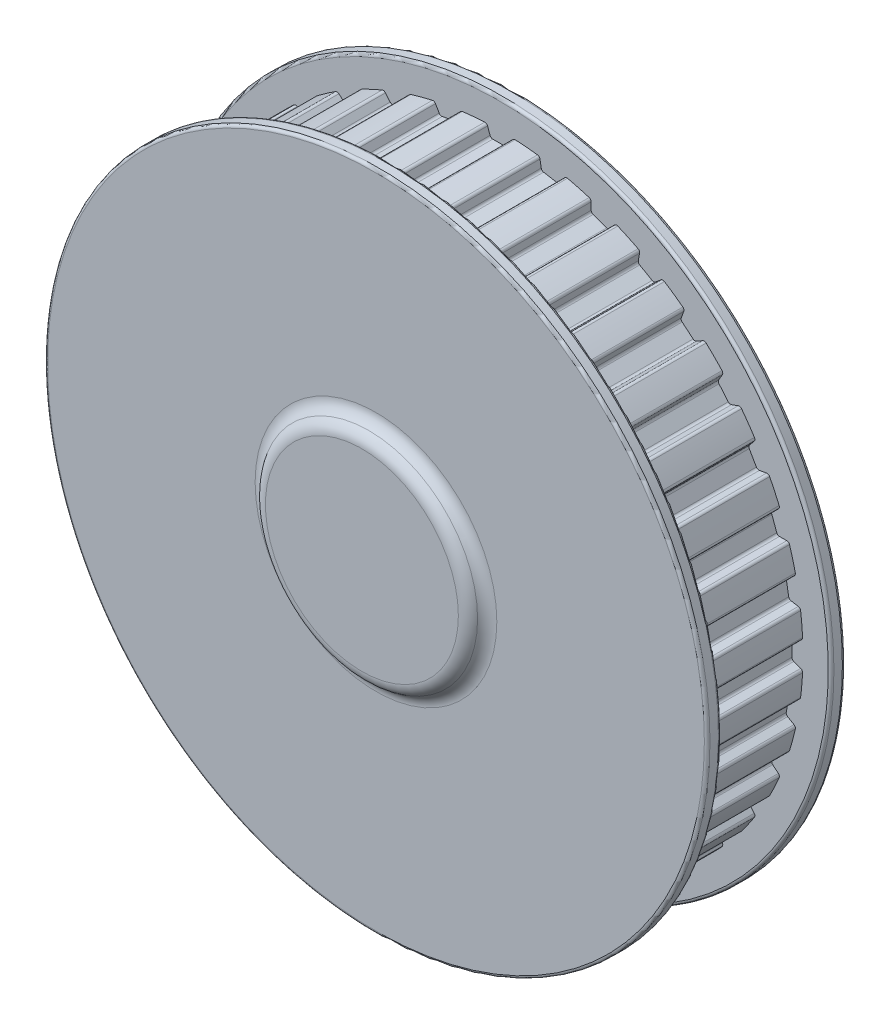
from build123d import *

# Parameters (mm, degrees)
BOSS_EXTRUDE1_DEPTH      = 7.25
BOSS_EXTRUDE1_DEPTH_BACK = 7.25
SKETCH7_R                = 53.784733566
CUT_EXTRUDE3_DEPTH       = 79.163899145
CUT_EXTRUDE3_DEPTH_BACK  = 79.163899145
SKETCH15_R               = 8.008120878
SKETCH15_R_2             = 2.25
BOSS_EXTRUDE2_DEPTH      = 5.5
SKETCH16_R               = 5
CUT_EXTRUDE4_DEPTH       = 3
BOSS_EXTRUDE3_START      = 7.5
SKETCH17_R               = 53.784733566
SKETCH17_R_2             = 5
BOSS_EXTRUDE3_DEPTH      = 7.5
CUT_EXTRUDE2_DEPTH       = 79.163899145
CUT_EXTRUDE2_DEPTH_BACK  = 79.163899145
FILLET2_R                = 0.51
BOSS_EXTRUDE4_START      = 2.5
SKETCH18_R               = 58.784733566
SKETCH18_R_2             = 53.784733566
SKETCH18_R_3             = 5
BOSS_EXTRUDE4_DEPTH      = 2.5
BOSS_EXTRUDE5_START      = -2.5
SKETCH19_R               = 58.784733566
SKETCH19_R_2             = 19
BOSS_EXTRUDE5_DEPTH      = 2.5
CUT_EXTRUDE5_DEPTH       = 91.298683827
FILLET3_R                = 0.5
CUT_EXTRUDE6_DEPTH       = 86.060506795
CUT_EXTRUDE6_DEPTH_BACK  = 86.060506795
SKETCH21_R               = 12.5
SKETCH22_R               = 18.951921224
CUT_EXTRUDE7_DEPTH       = 87.669139909
SKETCH22_2_R             = 18.951921224
BOSS_EXTRUDE6_DEPTH      = 2.5
FILLET4_R                = 2.5
FILLET5_R                = 2.5


with BuildPart() as part:
    # Sketch7 → Boss-Extrude1 (new, two sides: drawn at the far end of the back side and taken through both)
    with BuildSketch(Plane.XY.offset(-BOSS_EXTRUDE1_DEPTH_BACK)):
        Circle(SKETCH7_R)
    extrude(amount=BOSS_EXTRUDE1_DEPTH + BOSS_EXTRUDE1_DEPTH_BACK)

    # Sketch14 → Revolve1 (revolve)
    with BuildSketch(Plane(origin=(0, 0, 0), x_dir=(0, 0, -1), z_dir=(1, 0, 0)), mode=Mode.PRIVATE) as revolve1_sk:
        Polygon((-18, 6.739517467), (-18, 0), (0, 0), (0, 19), (-3.355534752, 19), (-11.020158508, 12.583105693), align=None)
        with BuildLine():
            ThreePointArc((-7.25, 19), (-8.580081567, 15.465471544), (-11.020158508, 12.583105693))
            Line((-11.020158508, 12.583105693), (-3.355534752, 19))
            Line((-3.355534752, 19), (-7.25, 19))
        make_face()
        with BuildLine():
            Line((-18, 10), (-18, 6.739517467))
            Line((-18, 6.739517467), (-11.020158508, 12.583105693))
            ThreePointArc((-11.020158508, 12.583105693), (-14.286666254, 10.687865845), (-18, 10))
        make_face()
    revolve(revolve1_sk.sketch.rotate(Axis((0, 0, -36.129595921), (0, 0, 1)), 270), axis=Axis((0, 0, -36.129595921), (0, 0, 1)))

    # Sketch10 → Cut-Extrude3 (cut, two sides: drawn at the far end of the back side and taken through both)
    with BuildSketch(Plane.XY.offset(-CUT_EXTRUDE3_DEPTH_BACK)):
        with BuildLine():
            Line((2.2, 7.7), (-2.2, 7.7))
            Line((-2.2, 7.7), (-2.2, 5.796550698))
            ThreePointArc((-2.2, 5.796550698), (0, 6.2), (2.2, 5.796550698))
            Line((2.2, 5.796550698), (2.2, 7.7))
        make_face()
        with BuildLine():
            ThreePointArc((2.2, 5.796550698), (0, 6.2), (-2.2, 5.796550698))
            Line((-2.2, 5.796550698), (-2.2, 0))
            Line((-2.2, 0), (2.2, 0))
            Line((2.2, 0), (2.2, 5.796550698))
        make_face()
        with BuildLine():
            Line((-2.2, 0), (-2.2, 5.796550698))
            ThreePointArc((-2.2, 5.796550698), (-3.521363372, -5.102940329), (6.2, 0))
            ThreePointArc((6.2, 0), (5.102940329, 3.521363372), (2.2, 5.796550698))
            Line((2.2, 5.796550698), (2.2, 0))
            Line((2.2, 0), (-2.2, 0))
        make_face()
    extrude(amount=CUT_EXTRUDE3_DEPTH + CUT_EXTRUDE3_DEPTH_BACK, mode=Mode.SUBTRACT)

    # Sketch15 → Boss-Extrude2 (add)
    with BuildSketch(Plane(origin=(0, 0, -7.25), x_dir=(-1, 0, 0), z_dir=(0, 0, -1))):
        Circle(SKETCH15_R)
        Circle(SKETCH15_R_2, mode=Mode.SUBTRACT)
    extrude(amount=-BOSS_EXTRUDE2_DEPTH)

    # Sketch16 → Cut-Extrude4 (cut)
    with BuildSketch(Plane(origin=(0, 0, -7.25), x_dir=(-1, 0, 0), z_dir=(0, 0, -1))):
        Circle(SKETCH16_R)
    extrude(amount=-CUT_EXTRUDE4_DEPTH, mode=Mode.SUBTRACT)

    # Sketch17 → Boss-Extrude3 (add)
    with BuildSketch(Plane(origin=(0, 0, -7.25), x_dir=(-1, 0, 0), z_dir=(0, 0, -1)).offset(BOSS_EXTRUDE3_START)):
        with Locations(Location((0, 0, 0), (0, 0, 180))):
            Circle(SKETCH17_R)
        Circle(SKETCH17_R_2, mode=Mode.SUBTRACT)
    extrude(amount=-BOSS_EXTRUDE3_DEPTH)

    # Sketch8 → Cut-Extrude2 (cut, two sides: drawn at the far end of the back side and taken through both)
    with BuildSketch(Plane.XY.offset(-CUT_EXTRUDE2_DEPTH_BACK)):
        Polygon((-1.629816853, 51.824457658), (-2.343298934, 53.784733566), (2.343298934, 53.784733566), (1.629816853, 51.824457658), align=None)
        Polygon((7.394166358, 51.320142423), (7.031922012, 53.374532199), (11.647319928, 52.56071302), (10.604278903, 50.754112971), align=None)
        Polygon((16.193481566, 49.256490631), (16.193481566, 51.34257268), (20.597443, 49.739661806), (19.256535305, 48.141630244), align=None)
        Polygon((24.500766031, 45.696205295), (24.863010377, 47.750595071), (28.921723189, 45.407296137), (27.323691627, 44.066388443), align=None)
        Polygon((32.063607118, 40.747463885), (32.777089199, 42.707739794), (36.367231454, 39.695252752), (34.560631404, 38.652211727), align=None)
        Polygon((38.652211727, 34.560631404), (39.695252752, 36.367231454), (42.707739794, 32.777089199), (40.747463885, 32.063607118), align=None)
        Polygon((44.066388443, 27.323691627), (45.407296137, 28.921723189), (47.750595071, 24.863010377), (45.696205295, 24.500766031), align=None)
        Polygon((48.141630244, 19.256535305), (49.739661806, 20.597443), (51.34257268, 16.193481566), (49.256490631, 16.193481566), align=None)
        Polygon((50.754112971, 10.604278903), (52.56071302, 11.647319928), (53.374532199, 7.031922012), (51.320142423, 7.394166358), align=None)
        Polygon((51.824457658, 1.629816853), (53.784733566, 2.343298934), (53.784733566, -2.343298934), (51.824457658, -1.629816853), align=None)
        Polygon((51.320142423, -7.394166358), (53.374532199, -7.031922012), (52.56071302, -11.647319928), (50.754112971, -10.604278903), align=None)
        Polygon((49.256490631, -16.193481566), (51.34257268, -16.193481566), (49.739661806, -20.597443), (48.141630244, -19.256535305), align=None)
        Polygon((45.696205295, -24.500766031), (47.750595071, -24.863010377), (45.407296137, -28.921723189), (44.066388443, -27.323691627), align=None)
        Polygon((40.747463885, -32.063607118), (42.707739794, -32.777089199), (39.695252752, -36.367231454), (38.652211727, -34.560631404), align=None)
        Polygon((34.560631404, -38.652211727), (36.367231454, -39.695252752), (32.777089199, -42.707739794), (32.063607118, -40.747463885), align=None)
        Polygon((27.323691627, -44.066388443), (28.921723189, -45.407296137), (24.863010377, -47.750595071), (24.500766031, -45.696205295), align=None)
        Polygon((19.256535305, -48.141630244), (20.597443, -49.739661806), (16.193481566, -51.34257268), (16.193481566, -49.256490631), align=None)
        Polygon((10.604278903, -50.754112971), (11.647319928, -52.56071302), (7.031922012, -53.374532199), (7.394166358, -51.320142423), align=None)
        Polygon((1.629816853, -51.824457658), (2.343298934, -53.784733566), (-2.343298934, -53.784733566), (-1.629816853, -51.824457658), align=None)
        Polygon((-7.394166358, -51.320142423), (-7.031922012, -53.374532199), (-11.647319928, -52.56071302), (-10.604278903, -50.754112971), align=None)
        Polygon((-16.193481566, -49.256490631), (-16.193481566, -51.34257268), (-20.597443, -49.739661806), (-19.256535305, -48.141630244), align=None)
        Polygon((-24.500766031, -45.696205295), (-24.863010377, -47.750595071), (-28.921723189, -45.407296137), (-27.323691627, -44.066388443), align=None)
        Polygon((-32.063607118, -40.747463885), (-32.777089199, -42.707739794), (-36.367231454, -39.695252752), (-34.560631404, -38.652211727), align=None)
        Polygon((-38.652211727, -34.560631404), (-39.695252752, -36.367231454), (-42.707739794, -32.777089199), (-40.747463885, -32.063607118), align=None)
        Polygon((-44.066388443, -27.323691627), (-45.407296137, -28.921723189), (-47.750595071, -24.863010377), (-45.696205295, -24.500766031), align=None)
        Polygon((-48.141630244, -19.256535305), (-49.739661806, -20.597443), (-51.34257268, -16.193481566), (-49.256490631, -16.193481566), align=None)
        Polygon((-50.754112971, -10.604278903), (-52.56071302, -11.647319928), (-53.374532199, -7.031922012), (-51.320142423, -7.394166358), align=None)
        Polygon((-51.824457658, -1.629816853), (-53.784733566, -2.343298934), (-53.784733566, 2.343298934), (-51.824457658, 1.629816853), align=None)
        Polygon((-51.320142423, 7.394166358), (-53.374532199, 7.031922012), (-52.56071302, 11.647319928), (-50.754112971, 10.604278903), align=None)
        Polygon((-49.256490631, 16.193481566), (-51.34257268, 16.193481566), (-49.739661806, 20.597443), (-48.141630244, 19.256535305), align=None)
        Polygon((-45.696205295, 24.500766031), (-47.750595071, 24.863010377), (-45.407296137, 28.921723189), (-44.066388443, 27.323691627), align=None)
        Polygon((-40.747463885, 32.063607118), (-42.707739794, 32.777089199), (-39.695252752, 36.367231454), (-38.652211727, 34.560631404), align=None)
        Polygon((-34.560631404, 38.652211727), (-36.367231454, 39.695252752), (-32.777089199, 42.707739794), (-32.063607118, 40.747463885), align=None)
        Polygon((-27.323691627, 44.066388443), (-28.921723189, 45.407296137), (-24.863010377, 47.750595071), (-24.500766031, 45.696205295), align=None)
        Polygon((-19.256535305, 48.141630244), (-20.597443, 49.739661806), (-16.193481566, 51.34257268), (-16.193481566, 49.256490631), align=None)
        Polygon((-10.604278903, 50.754112971), (-11.647319928, 52.56071302), (-7.031922012, 53.374532199), (-7.394166358, 51.320142423), align=None)
    extrude(amount=CUT_EXTRUDE2_DEPTH + CUT_EXTRUDE2_DEPTH_BACK, mode=Mode.SUBTRACT)

    # Fillet2
    fillet2_edges = [part.edges().sort_by_distance(p)[0] for p in [
        (-36.320896926, 39.6685015, -3.75),
        (-32.758790265, 42.657463885, -3.75),
        (-32.063607118, 40.747463885, -3.75),
        (-34.560631404, 38.652211727, -3.75),
        (-42.657463885, 32.758790265, -3.75),
        (-39.6685015, 36.320896926, -3.75),
        (-38.652211727, 34.560631404, -3.75),
        (-40.747463885, 32.063607118, -3.75),
        (-47.69790539, 24.853719765, -3.75),
        (-45.37290539, 28.880737893, -3.75),
        (-44.066388443, 27.323691627, -3.75),
        (-45.696205295, 24.500766031, -3.75),
        (-51.289070176, 16.193481566, -3.75),
        (-49.69867651, 20.563052253, -3.75),
        (-48.141630244, 19.256535305, -3.75),
        (-49.256490631, 16.193481566, -3.75),
        (-53.321842518, 7.041212624, -3.75),
        (-52.514378492, 11.620568676, -3.75),
        (-50.754112971, 10.604278903, -3.75),
        (-51.320142423, 7.394166358, -3.75),
        (-53.734457658, -2.325, -3.75),
        (-53.734457658, 2.325, -3.75),
        (-51.824457658, 1.629816853, -3.75),
        (-51.824457658, -1.629816853, -3.75),
        (-52.514378492, -11.620568676, -3.75),
        (-53.321842518, -7.041212624, -3.75),
        (-51.320142423, -7.394166358, -3.75),
        (-50.754112971, -10.604278903, -3.75),
        (-49.69867651, -20.563052253, -3.75),
        (-51.289070176, -16.193481566, -3.75),
        (-49.256490631, -16.193481566, -3.75),
        (-48.141630244, -19.256535305, -3.75),
        (-45.37290539, -28.880737893, -3.75),
        (-47.69790539, -24.853719765, -3.75),
        (-45.696205295, -24.500766031, -3.75),
        (-44.066388443, -27.323691627, -3.75),
        (-39.6685015, -36.320896926, -3.75),
        (-42.657463885, -32.758790265, -3.75),
        (-40.747463885, -32.063607118, -3.75),
        (-38.652211727, -34.560631404, -3.75),
        (-32.758790265, -42.657463885, -3.75),
        (-36.320896926, -39.6685015, -3.75),
        (-34.560631404, -38.652211727, -3.75),
        (-32.063607118, -40.747463885, -3.75),
        (-24.853719765, -47.69790539, -3.75),
        (-28.880737893, -45.37290539, -3.75),
        (-27.323691627, -44.066388443, -3.75),
        (-24.500766031, -45.696205295, -3.75),
        (-16.193481566, -51.289070176, -3.75),
        (-20.563052253, -49.69867651, -3.75),
        (-19.256535305, -48.141630244, -3.75),
        (-16.193481566, -49.256490631, -3.75),
        (-7.041212624, -53.321842518, -3.75),
        (-11.620568676, -52.514378492, -3.75),
        (-10.604278903, -50.754112971, -3.75),
        (-7.394166358, -51.320142423, -3.75),
        (2.325, -53.734457658, -3.75),
        (-2.325, -53.734457658, -3.75),
        (-1.629816853, -51.824457658, -3.75),
        (1.629816853, -51.824457658, -3.75),
        (11.620568676, -52.514378492, -3.75),
        (7.041212624, -53.321842518, -3.75),
        (7.394166358, -51.320142423, -3.75),
        (10.604278903, -50.754112971, -3.75),
        (45.37290539, 28.880737893, -3.75),
        (47.69790539, 24.853719765, -3.75),
        (45.696205295, 24.500766031, -3.75),
        (44.066388443, 27.323691627, -3.75),
        (39.6685015, 36.320896926, -3.75),
        (42.657463885, 32.758790265, -3.75),
        (40.747463885, 32.063607118, -3.75),
        (38.652211727, 34.560631404, -3.75),
        (32.758790265, 42.657463885, -3.75),
        (36.320896926, 39.6685015, -3.75),
        (34.560631404, 38.652211727, -3.75),
        (32.063607118, 40.747463885, -3.75),
        (24.853719765, 47.69790539, -3.75),
        (28.880737893, 45.37290539, -3.75),
        (27.323691627, 44.066388443, -3.75),
        (24.500766031, 45.696205295, -3.75),
        (16.193481566, 51.289070176, -3.75),
        (20.563052253, 49.69867651, -3.75),
        (19.256535305, 48.141630244, -3.75),
        (16.193481566, 49.256490631, -3.75),
        (7.041212624, 53.321842518, -3.75),
        (11.620568676, 52.514378492, -3.75),
        (10.604278903, 50.754112971, -3.75),
        (7.394166358, 51.320142423, -3.75),
        (20.563052253, -49.69867651, -3.75),
        (16.193481566, -51.289070176, -3.75),
        (16.193481566, -49.256490631, -3.75),
        (19.256535305, -48.141630244, -3.75),
        (28.880737893, -45.37290539, -3.75),
        (24.853719765, -47.69790539, -3.75),
        (24.500766031, -45.696205295, -3.75),
        (27.323691627, -44.066388443, -3.75),
        (49.69867651, 20.563052253, -3.75),
        (51.289070176, 16.193481566, -3.75),
        (49.256490631, 16.193481566, -3.75),
        (48.141630244, 19.256535305, -3.75),
        (52.514378492, 11.620568676, -3.75),
        (53.321842518, 7.041212624, -3.75),
        (51.320142423, 7.394166358, -3.75),
        (50.754112971, 10.604278903, -3.75),
        (53.734457658, 2.325, -3.75),
        (53.734457658, -2.325, -3.75),
        (51.824457658, -1.629816853, -3.75),
        (51.824457658, 1.629816853, -3.75),
        (53.321842518, -7.041212624, -3.75),
        (52.514378492, -11.620568676, -3.75),
        (50.754112971, -10.604278903, -3.75),
        (51.320142423, -7.394166358, -3.75),
        (51.289070176, -16.193481566, -3.75),
        (49.69867651, -20.563052253, -3.75),
        (48.141630244, -19.256535305, -3.75),
        (49.256490631, -16.193481566, -3.75),
        (47.69790539, -24.853719765, -3.75),
        (45.37290539, -28.880737893, -3.75),
        (44.066388443, -27.323691627, -3.75),
        (45.696205295, -24.500766031, -3.75),
        (42.657463885, -32.758790265, -3.75),
        (39.6685015, -36.320896926, -3.75),
        (38.652211727, -34.560631404, -3.75),
        (40.747463885, -32.063607118, -3.75),
        (36.320896926, -39.6685015, -3.75),
        (32.758790265, -42.657463885, -3.75),
        (32.063607118, -40.747463885, -3.75),
        (34.560631404, -38.652211727, -3.75),
        (-28.880737893, 45.37290539, -3.75),
        (-24.853719765, 47.69790539, -3.75),
        (-24.500766031, 45.696205295, -3.75),
        (-27.323691627, 44.066388443, -3.75),
        (-20.563052253, 49.69867651, -3.75),
        (-16.193481566, 51.289070176, -3.75),
        (-16.193481566, 49.256490631, -3.75),
        (-19.256535305, 48.141630244, -3.75),
        (-11.620568676, 52.514378492, -3.75),
        (-7.041212624, 53.321842518, -3.75),
        (-7.394166358, 51.320142423, -3.75),
        (-10.604278903, 50.754112971, -3.75),
        (-2.325, 53.734457658, -3.75),
        (2.325, 53.734457658, -3.75),
        (1.629816853, 51.824457658, -3.75),
        (-1.629816853, 51.824457658, -3.75),
    ]]
    fillet(fillet2_edges, radius=FILLET2_R)

    # Sketch18 → Boss-Extrude4 (add)
    # profile 1 of 2: a face of its own
    with BuildSketch(Plane(origin=(0, 0, -14.75), x_dir=(-1, 0, 0), z_dir=(0, 0, -1)).offset(BOSS_EXTRUDE4_START)):
        Circle(SKETCH18_R)
        Circle(SKETCH18_R_2, mode=Mode.SUBTRACT)
    # profile 2 of 2: a face of its own
    with BuildSketch(Plane(origin=(0, 0, -14.75), x_dir=(-1, 0, 0), z_dir=(0, 0, -1)).offset(BOSS_EXTRUDE4_START)):
        Circle(SKETCH18_R_2)
        Circle(SKETCH18_R_3, mode=Mode.SUBTRACT)
    extrude(amount=-BOSS_EXTRUDE4_DEPTH)

    # Sketch19 → Boss-Extrude5 (add)
    with BuildSketch(Plane.XY.offset(7.25).offset(BOSS_EXTRUDE5_START)):
        with Locations(Location((0, 0, 0), (0, 0, 180))):
            Circle(SKETCH19_R)
        Circle(SKETCH19_R_2, mode=Mode.SUBTRACT)
    extrude(amount=BOSS_EXTRUDE5_DEPTH)

    # Sketch20 → Cut-Extrude5 (cut, through all)
    with BuildSketch(Plane.XY.offset(18)):
        with BuildLine():
            Line((-2.2, 7.7), (-2.2, 5.796550698))
            ThreePointArc((-2.2, 5.796550698), (0, 6.2), (2.2, 5.796550698))
            Line((2.2, 5.796550698), (2.2, 7.7))
            Line((2.2, 7.7), (-2.2, 7.7))
        make_face()
        with BuildLine():
            ThreePointArc((2.2, 5.796550698), (0, 6.2), (-2.2, 5.796550698))
            ThreePointArc((-2.2, 5.796550698), (-3.521363372, -5.102940329), (6.2, 0))
            ThreePointArc((6.2, 0), (5.102940329, 3.521363372), (2.2, 5.796550698))
        make_face()
    extrude(amount=-CUT_EXTRUDE5_DEPTH, mode=Mode.SUBTRACT)

    # Fillet3
    fillet3_edges = [part.edges().sort_by_distance(p)[0] for p in [
        (0, 7.7, 18),
        (2.2, 6.748275349, 18),
        (58.784733566, 0, -14.75),
        (58.784733566, 0, -17.25),
        (-2.2, 6.748275349, 18),
        (0, -6.2, 18),
        (58.784733566, 0, 4.75),
        (58.784733566, 0, 7.25),
        (2.2, 5.796550698, 0.375),
        (-2.2, 5.796550698, 0.375),
        (-19, 0, 7.25),
        (-10, 0, 18),
    ]]
    fillet(fillet3_edges, radius=FILLET3_R)

    # Sketch21 → Cut-Extrude6 (cut, two sides: drawn at the far end of the back side and taken through both)
    with BuildSketch(Plane.XY.offset(-CUT_EXTRUDE6_DEPTH_BACK)):
        Circle(SKETCH21_R)
    extrude(amount=CUT_EXTRUDE6_DEPTH + CUT_EXTRUDE6_DEPTH_BACK, mode=Mode.SUBTRACT)

    # Sketch22 → Cut-Extrude7 (cut, through all)
    with BuildSketch(Plane.XY.offset(7.25)):
        Circle(SKETCH22_R)
    extrude(amount=CUT_EXTRUDE7_DEPTH, mode=Mode.SUBTRACT)

    # Sketch22<2> → Boss-Extrude6 (add)
    with BuildSketch(Plane.XY.offset(7.25)):
        Circle(SKETCH22_2_R)
    extrude(amount=BOSS_EXTRUDE6_DEPTH)

    # Fillet4
    fillet4_edges = [part.edges().sort_by_distance(p)[0] for p in [
        (-18.951921224, 0, 7.259288608),
    ]]
    fillet(fillet4_edges, radius=FILLET4_R - 0.0004)  # a hair under: the kernel refuses the full size

    # Fillet5
    fillet5_edges = [part.edges().sort_by_distance(p)[0] for p in [
        (-18.951921224, 0, 9.75),
    ]]
    fillet(fillet5_edges, radius=FILLET5_R)


solid = part.part
